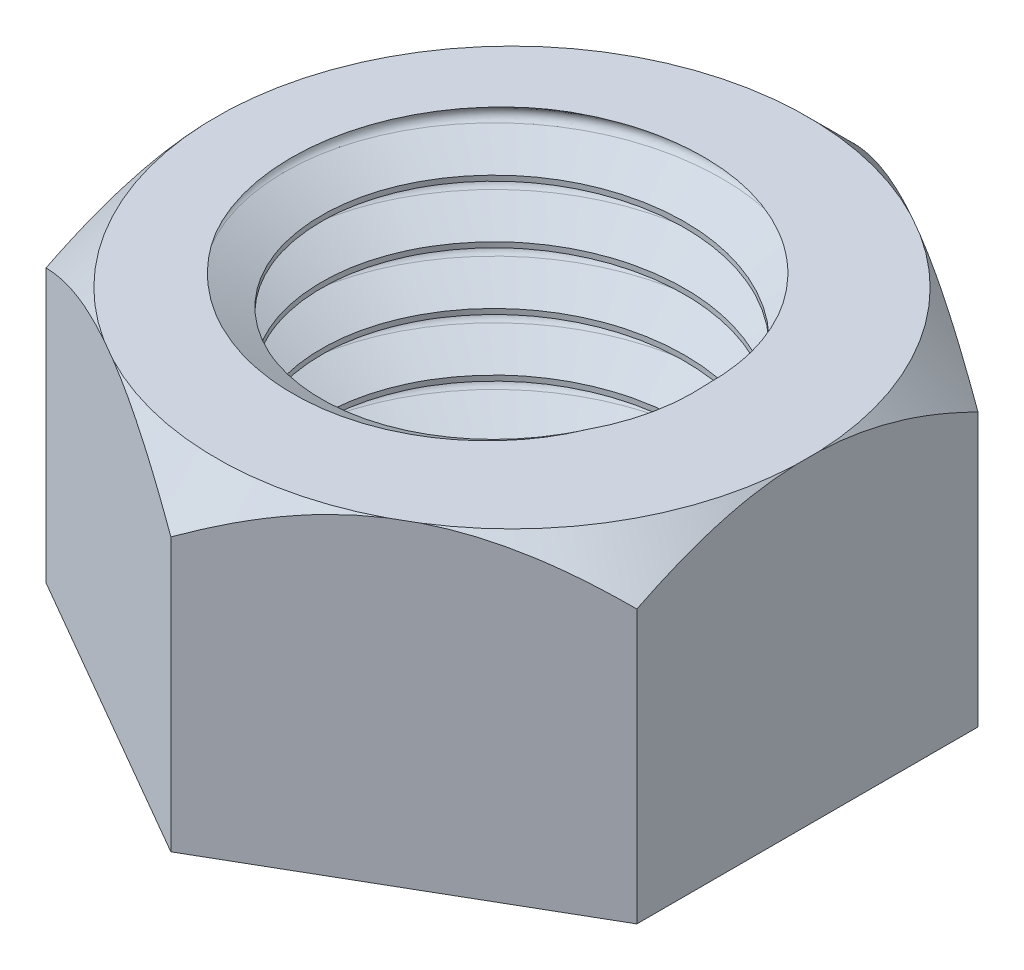
from build123d import *

# Parameters (mm, degrees)
SKETCH1_R           = 4
BOSS_EXTRUDE1_DEPTH = 7
CUT_SWEEP1_PITCH    = 1.27


with BuildPart() as part:
    # Sketch1 → Boss-Extrude1 (new body)
    with BuildSketch(Plane(origin=(0, 0, 0), x_dir=(1, 0, 0), z_dir=(0, 1, 0))):
        Polygon((6.5, -3.75277675), (6.5, 3.75277675), (0, 7.505553499), (-6.5, 3.75277675), (-6.5, -3.75277675), (0, -7.505553499), align=None)
        with Locations(Location((0, 0, 0), (0, 0, 270))):
            Circle(SKETCH1_R, mode=Mode.SUBTRACT)
    extrude(amount=BOSS_EXTRUDE1_DEPTH)

    # Cut-Sweep1: arcs per turn and ends read off the stored shape
    # Cut-Sweep1: the profile of Sketch3 screwed along a right-hand helix through 7 turns, 8 arcs to a turn; built about Z, then put on its axis
    cut_sweep1_z = Axis((0, 0, 0), (0, 0, 1))
    cut_sweep1_corners = [(3.912700023, 0, -1.935197898), (4.813044281, 0, -1.466508343), (4.906700023, 0, -1.312168458), (4.813044281, 0, -1.157828573), (3.912700023, 0, -0.689139017)]
    with BuildLine(mode=Mode.PRIVATE) as cut_sweep1_profile:
        Line(cut_sweep1_corners[0], cut_sweep1_corners[1])
        Line(cut_sweep1_corners[3], cut_sweep1_corners[4])
        Line(cut_sweep1_corners[4], cut_sweep1_corners[0])
        ThreePointArc((4.813044281, 0, -1.466508343), (4.881454688, 0, -1.402435005), (4.906700023, 0, -1.312168458))
        ThreePointArc((4.906700023, 0, -1.312168458), (4.881454688, 0, -1.221901911), (4.813044281, 0, -1.157828573))
    cut_sweep1_cap = Face(cut_sweep1_profile.wire())
    cut_sweep1_arcs = [((4.813044281, 0, -1.466508343), (4.906700023, 0, -1.41775425), (4.906700023, 0, -1.312168458), (1, 0.8549118706729462, 1)), ((4.906700023, 0, -1.312168458), (4.906700023, 0, -1.206582666), (4.813044281, 0, -1.157828573), (1, 0.8549118706729462, 1))]  # start, shoulder, end, weights
    cut_sweep1_turn_angles = [0, 22.5, 45, 67.5, 90, 112.5, 135, 157.5, 180, 202.5, 225, 247.5, 270, 292.5, 315, 337.5, 360]
    cut_sweep1_turn_weights = [1, 0.9238795325112867, 1, 0.9238795325112867, 1, 0.9238795325112867, 1, 0.9238795325112867, 1, 0.9238795325112867, 1, 0.9238795325112867, 1, 0.9238795325112867, 1, 0.9238795325112867, 1]
    cut_sweep1_turn_rails = [Edge.make_bspline([Vector(p[0], p[1], 0).rotate(cut_sweep1_z, cut_sweep1_turn_angles[k]) / cut_sweep1_turn_weights[k] + Vector(0, 0, p[2] + CUT_SWEEP1_PITCH * cut_sweep1_turn_angles[k] / 360) for k in range(17)], [0, 0, 0, 1, 1, 2, 2, 3, 3, 4, 4, 5, 5, 6, 6, 7, 7, 8, 8, 8], 2, cut_sweep1_turn_weights) for p in cut_sweep1_corners]
    cut_sweep1_turn_sides = [*[Face.make_surface_from_curves(cut_sweep1_turn_rails[p[0]], cut_sweep1_turn_rails[p[1]]) for p in [(0, 1), (3, 4), (4, 0)]], *[Face.make_bezier_surface([[Vector(p[j][0], p[j][1], 0).rotate(cut_sweep1_z, cut_sweep1_turn_angles[2 * i + k]) / cut_sweep1_turn_weights[2 * i + k] + Vector(0, 0, p[j][2] + CUT_SWEEP1_PITCH * cut_sweep1_turn_angles[2 * i + k] / 360) for k in range(3)] for j in range(3)], [[p[3][j] * cut_sweep1_turn_weights[2 * i + k] for k in range(3)] for j in range(3)]) for p in cut_sweep1_arcs for i in range(8)]]
    cut_sweep1 = Plane(origin=(0, 7, 0), x_dir=(-1, 0, 0), z_dir=(0, -1, 0)) * Solid(Shell([*[p.moved(Location((0, 0, CUT_SWEEP1_PITCH * i))) for i in range(7) for p in cut_sweep1_turn_sides], cut_sweep1_cap, cut_sweep1_cap.rotate(cut_sweep1_z, 2520).moved(Location((0, 0, CUT_SWEEP1_PITCH * 2520 / 360)))]))
    add(cut_sweep1, mode=Mode.SUBTRACT)

    # Sketch5 → Cut-Revolve1 (revolve, cut)
    with BuildSketch(Plane(origin=(0, 0, 0), x_dir=(0.8660254037844386, 0, 0.4999999999999999), z_dir=(-0.49999999999999994, 0, 0.8660254037844387))):
        Polygon((6.505553499, 7), (7.505553499, 6), (7.505553499, 7), align=None)
    revolve(axis=Axis((0, 0, 0), (0, 1, 0)), mode=Mode.SUBTRACT)


solid = part.part
